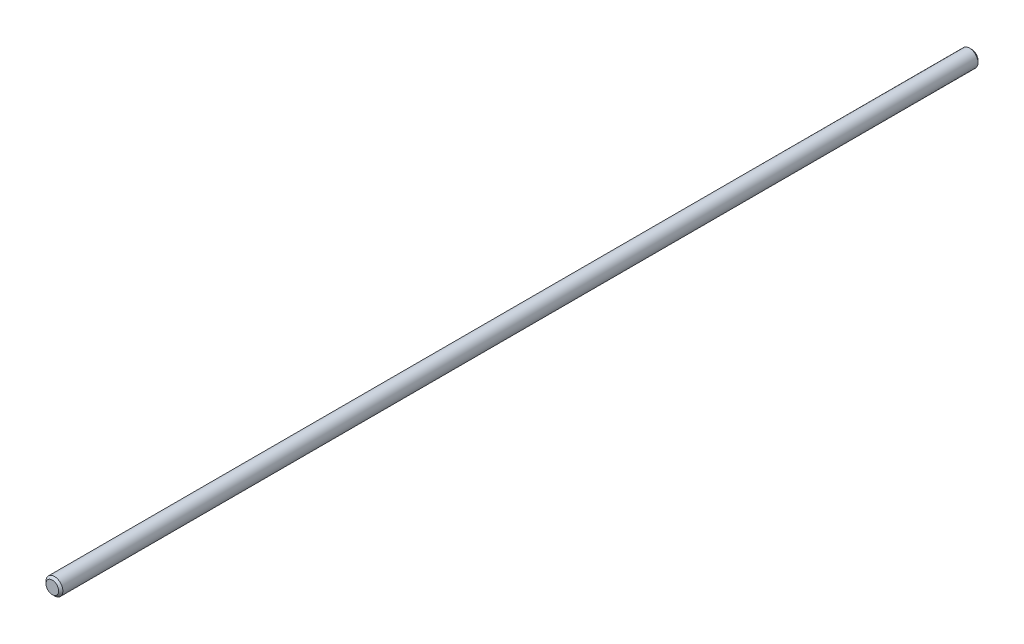
from build123d import *

# Parameters (mm, degrees)
SCHIZZO1_R                   = 4
ESTRUSIONE_ESTRUSIONE1_DEPTH = 436
SMUSSO1_SIZE                 = 1


with BuildPart() as part:
    # Schizzo1 → Estrusione-Estrusione1 (new body)
    with BuildSketch(Plane.XY):
        Circle(SCHIZZO1_R)
    extrude(amount=ESTRUSIONE_ESTRUSIONE1_DEPTH)

    # Smusso1
    smusso1_edges = [part.edges().sort_by_distance(p)[0] for p in [
        (-4, 0, 436),
        (-4, 0, 0),
    ]]
    chamfer(smusso1_edges, length=SMUSSO1_SIZE)


solid = part.part
